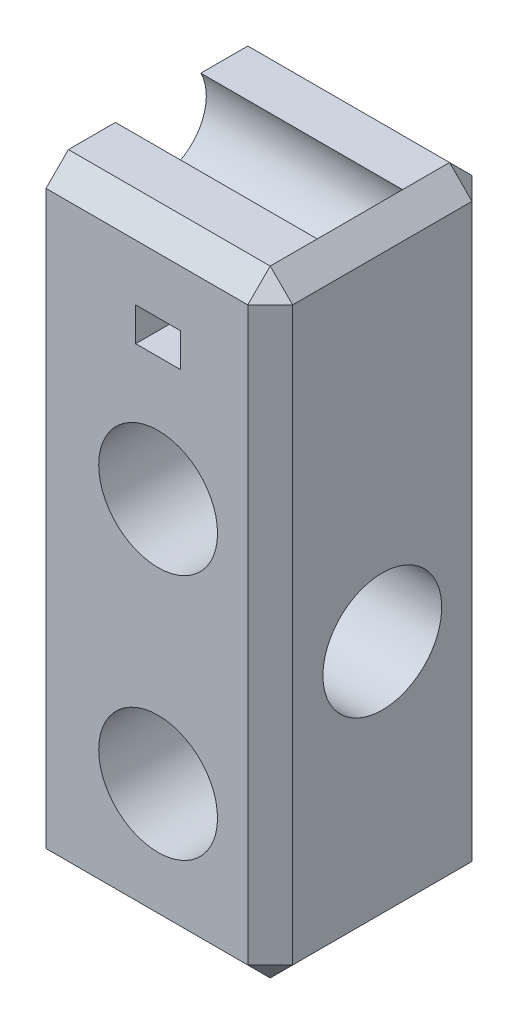
from build123d import *

# Parameters (mm, degrees)
SKETCH1_W               = 20
SKETCH1_H               = 20
BOSS_EXTRUDE1_DEPTH     = 55
CUT_EXTRUDE1_DEPTH      = 60.371710435
CUT_EXTRUDE1_DEPTH_BACK = 60.371710435
SKETCH2_R               = 5.3
SKETCH2_W               = 4
SKETCH2_H               = 3
SKETCH3_R               = 5.3
CUT_EXTRUDE2_DEPTH      = 60.371710435
SKETCH4_R               = 4.3
CUT_EXTRUDE3_DEPTH      = 18
CHAMFER1_SIZE           = 2


with BuildPart() as part:
    # Sketch1 → Boss-Extrude1 (new body)
    with BuildSketch(Plane(origin=(0, 0, 0), x_dir=(1, 0, 0), z_dir=(0, 1, 0))):
        Rectangle(SKETCH1_W, SKETCH1_H)
    extrude(amount=BOSS_EXTRUDE1_DEPTH)

    # Sketch2 → Cut-Extrude1 (cut, two sides: drawn at the far end of the back side and taken through both)
    with BuildSketch(Plane.XY.offset(10).offset(-CUT_EXTRUDE1_DEPTH_BACK)):
        with Locations((0, 12)):
            Circle(SKETCH2_R)
        with Locations((0, 34)):
            Circle(SKETCH2_R)
        with Locations((0, 46.5)):
            Rectangle(SKETCH2_W, SKETCH2_H)
    extrude(amount=CUT_EXTRUDE1_DEPTH + CUT_EXTRUDE1_DEPTH_BACK, mode=Mode.SUBTRACT)

    # Sketch3 → Cut-Extrude2 (cut, through all)
    with BuildSketch(Plane.ZY.offset(10)):
        with Locations((0, 23)):
            Circle(SKETCH3_R)
    extrude(amount=-CUT_EXTRUDE2_DEPTH, mode=Mode.SUBTRACT)

    # Sketch4 → Cut-Extrude3 (cut)
    with BuildSketch(Plane.ZY.offset(10)):
        with Locations((0, 53)):
            Circle(SKETCH4_R)
    extrude(amount=-CUT_EXTRUDE3_DEPTH, mode=Mode.SUBTRACT)

    # Chamfer1
    chamfer1_edges = [part.edges().sort_by_distance(p)[0] for p in [
        (10, 55, 0),
        (0, 55, -10),
        (0, 0, -10),
        (10, 0, 0),
        (0, 0, 10),
        (0, 55, 10),
        (10, 27.5, -10),
        (10, 27.5, 10),
    ]]
    chamfer(chamfer1_edges, length=CHAMFER1_SIZE - 0.0001)  # a hair under: the kernel refuses the full size


solid = part.part
